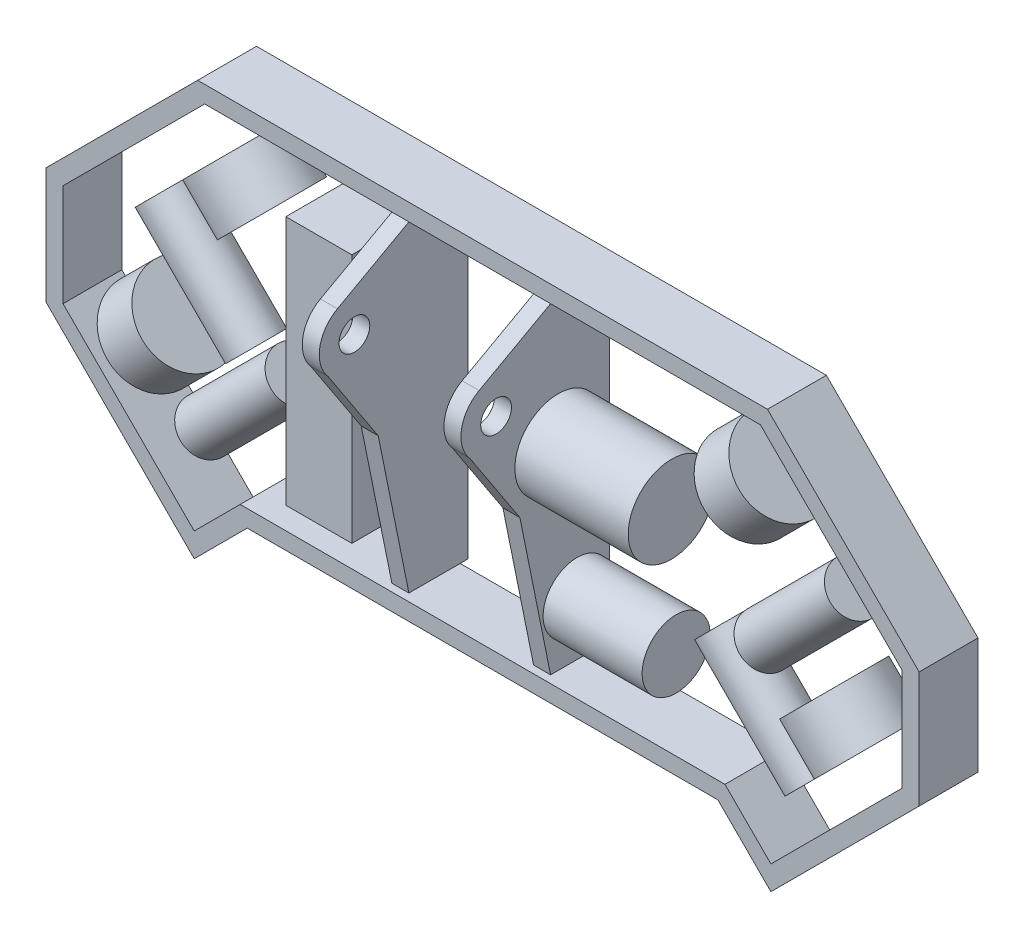
from build123d import *

# Parameters (mm, degrees)
BOSS_EXTRUDE1_OUTLINE_W = 37
BOSS_EXTRUDE1_OUTLINE_H = 140
BOSS_EXTRUDE1_DEPTH     = 45
BOSS_EXTRUDE10_START    = 45.72
SKETCH9_R               = 19.05
BOSS_EXTRUDE10_DEPTH    = 55.488642
BOSS_EXTRUDE11_START    = 38.1
SKETCH9_3_R             = 24.264839711
BOSS_EXTRUDE11_DEPTH    = 63.5
SKETCH2_R               = 25
BOSS_EXTRUDE6_DEPTH     = 27.5
SKETCH3_R               = 25
BOSS_EXTRUDE7_DEPTH     = 27.5
SKETCH4_R               = 14
BOSS_EXTRUDE8_DEPTH     = 71.6
SKETCH5_R               = 14
BOSS_EXTRUDE9_DEPTH     = 71.6
BOSS_EXTRUDE12_START    = -41.275
SKETCH8_R               = 8.612326573
BOSS_EXTRUDE12_DEPTH    = 9.525
BOSS_EXTRUDE13_START    = 28.575
SKETCH8_3_R             = 8.612326573
BOSS_EXTRUDE13_DEPTH    = 9.525
EXTRUDE_THIN2_DEPTH     = 32.9768


# Read off the part's stored shape, not the designer's step: Boss-Extrude1
with BuildPart() as part:
    # Boss-Extrude1 outline → Boss-Extrude1 (new body)
    with BuildSketch(Plane.XY):
        with Locations((-79.704052147, -89.933835326)):
            Rectangle(BOSS_EXTRUDE1_OUTLINE_W, BOSS_EXTRUDE1_OUTLINE_H)
    extrude(amount=BOSS_EXTRUDE1_DEPTH)


with BuildPart() as body_2:
    # Sketch9 → Boss-Extrude10 (new body)
    with BuildSketch(Plane(origin=(0, 0, 0), x_dir=(0, 0, -1), z_dir=(1, 0, 0)).offset(BOSS_EXTRUDE10_START)):
        with Locations((-25.749228435, -141.973618126)):
            Circle(SKETCH9_R)
    extrude(amount=BOSS_EXTRUDE10_DEPTH)


with BuildPart() as body_3:
    # Sketch9<3> → Boss-Extrude11 (new body)
    with BuildSketch(Plane(origin=(0, 0, 0), x_dir=(0, 0, -1), z_dir=(1, 0, 0)).offset(BOSS_EXTRUDE11_START)):
        with Locations((-28.735809635, -70.080189422)):
            Circle(SKETCH9_3_R)
    extrude(amount=BOSS_EXTRUDE11_DEPTH)

    # Sketch8<3> → Boss-Extrude13 (add)
    with BuildSketch(Plane(origin=(0, 0, 0), x_dir=(0, 0, -1), z_dir=(1, 0, 0)).offset(BOSS_EXTRUDE13_START)):
        with BuildLine():
            Line((-32.976800838, 0), (-73.018851768, -22.129862401))
            ThreePointArc((-73.018851768, -22.129862401), (-82.891392915, -36.001914614), (-78.247578803, -52.382875873))
            Line((-78.247578803, -52.382875873), (-50.160237425, -95.1885073))
            Line((-50.160237425, -95.1885073), (-32.976800838, -180.080796112))
            Line((-32.976800838, -180.080796112), (0, -180.080796112))
            Line((0, -180.080796112), (0, 0))
            Line((0, 0), (-32.976800838, 0))
        make_face()
        with Locations((-63.5, -39.353392326)):
            Circle(SKETCH8_3_R, mode=Mode.SUBTRACT)
    extrude(amount=BOSS_EXTRUDE13_DEPTH)


with BuildPart() as body_4:
    # Sketch2 → Boss-Extrude6 (new body)
    with BuildSketch(Plane(origin=(-62.5136693, 62.5136693, 0), x_dir=(0, 0, 1), z_dir=(0.707106781186475, -0.7071067811866201, 0))):
        with Locations(Location((17.38, 127.952586842, 0), (0, 0, 270))):
            Circle(SKETCH2_R)
    extrude(amount=BOSS_EXTRUDE6_DEPTH)


with BuildPart() as body_5:
    # Sketch3 → Boss-Extrude7 (new body)
    with BuildSketch(Plane(origin=(-171.344845243, -171.344845243, 0), x_dir=(0, 0, -1), z_dir=(0.7071067811866171, 0.7071067811864781, 0))):
        with Locations(Location((-17.38, 41.774129956, 0), (0, 0, 90))):
            Circle(SKETCH3_R)
    extrude(amount=BOSS_EXTRUDE7_DEPTH)


with BuildPart() as body_6:
    # Sketch4 → Boss-Extrude8 (new body)
    with BuildSketch(Plane(origin=(-62.5136693, 62.5136693, 0), x_dir=(0, 0, 1), z_dir=(0.707106781186475, -0.7071067811866201, 0))):
        with Locations(Location((17.38, 184.60854676, 0), (0, 0, 270))):
            Circle(SKETCH4_R)
    extrude(amount=BOSS_EXTRUDE8_DEPTH)


with BuildPart() as body_7:
    # Sketch5 → Boss-Extrude9 (new body)
    with BuildSketch(Plane(origin=(-171.344845243, -171.344845243, 0), x_dir=(0, 0, -1), z_dir=(0.7071067811866171, 0.7071067811864781, 0))):
        with Locations(Location((-17.38, -0.593852938, 0), (0, 0, 270))):
            Circle(SKETCH5_R)
    extrude(amount=BOSS_EXTRUDE9_DEPTH)


with BuildPart() as body_8:
    # Sketch8 → Boss-Extrude12 (new body)
    with BuildSketch(Plane(origin=(0, 0, 0), x_dir=(0, 0, -1), z_dir=(1, 0, 0)).offset(BOSS_EXTRUDE12_START)):
        with BuildLine():
            Line((-32.976800838, 0), (-73.018851768, -22.129862401))
            ThreePointArc((-73.018851768, -22.129862401), (-82.891392915, -36.001914614), (-78.247578803, -52.382875873))
            Line((-78.247578803, -52.382875873), (-50.160237425, -95.1885073))
            Line((-50.160237425, -95.1885073), (-32.976800838, -180.080796112))
            Line((-32.976800838, -180.080796112), (0, -180.080796112))
            Line((0, -180.080796112), (0, 0))
            Line((0, 0), (-32.976800838, 0))
        make_face()
        with Locations((-63.5, -39.353392326)):
            Circle(SKETCH8_R, mode=Mode.SUBTRACT)
    extrude(amount=-BOSS_EXTRUDE12_DEPTH)


with BuildPart() as body_9:
    # Mirror3: mirrored copy
    add(body_4.part.mirror(Plane(origin=(0, 0, 0), x_dir=(0, 0, 1), z_dir=(1, 0, 0))))


with BuildPart() as body_10:
    # Mirror3 2: mirrored copy
    add(body_6.part.mirror(Plane(origin=(0, 0, 0), x_dir=(0, 0, 1), z_dir=(1, 0, 0))))


with BuildPart() as body_11:
    # Mirror3 3: mirrored copy
    add(body_5.part.mirror(Plane(origin=(0, 0, 0), x_dir=(0, 0, 1), z_dir=(1, 0, 0))))


with BuildPart() as body_12:
    # Mirror3 4: mirrored copy
    add(body_7.part.mirror(Plane(origin=(0, 0, 0), x_dir=(0, 0, 1), z_dir=(1, 0, 0))))


with BuildPart() as body_13:
    # Sketch10 → Extrude-Thin2 (new body)
    with BuildSketch(Plane(origin=(0, 0, 0), x_dir=(-1, 0, 0), z_dir=(0, 0, -1))):
        Polygon((159.609429883, 9.525), (-159.609429883, 9.525), (-244.565967416, -75.431537533), (-244.565967416, -140.538221375), (-161.535839062, -223.568349729), (-131.836833268, -193.869343934), (131.836833268, -193.869343934), (161.535839062, -223.568349729), (244.565967416, -140.538221375), (244.565967416, -75.431537533), align=None)
        Polygon((155.664045701, 0), (-155.664045701, 0), (-235.040967416, -79.376921715), (-235.040967416, -136.592837193), (-161.535839062, -210.097965547), (-135.782217449, -184.344343934), (135.782217449, -184.344343934), (161.535839062, -210.097965547), (235.040967416, -136.592837193), (235.040967416, -79.376921715), align=None, mode=Mode.SUBTRACT)
    extrude(amount=-EXTRUDE_THIN2_DEPTH)


solid = Compound([part.part, body_2.part, body_3.part, body_4.part, body_5.part, body_6.part, body_7.part, body_8.part, body_9.part, body_10.part, body_11.part, body_12.part, body_13.part])
